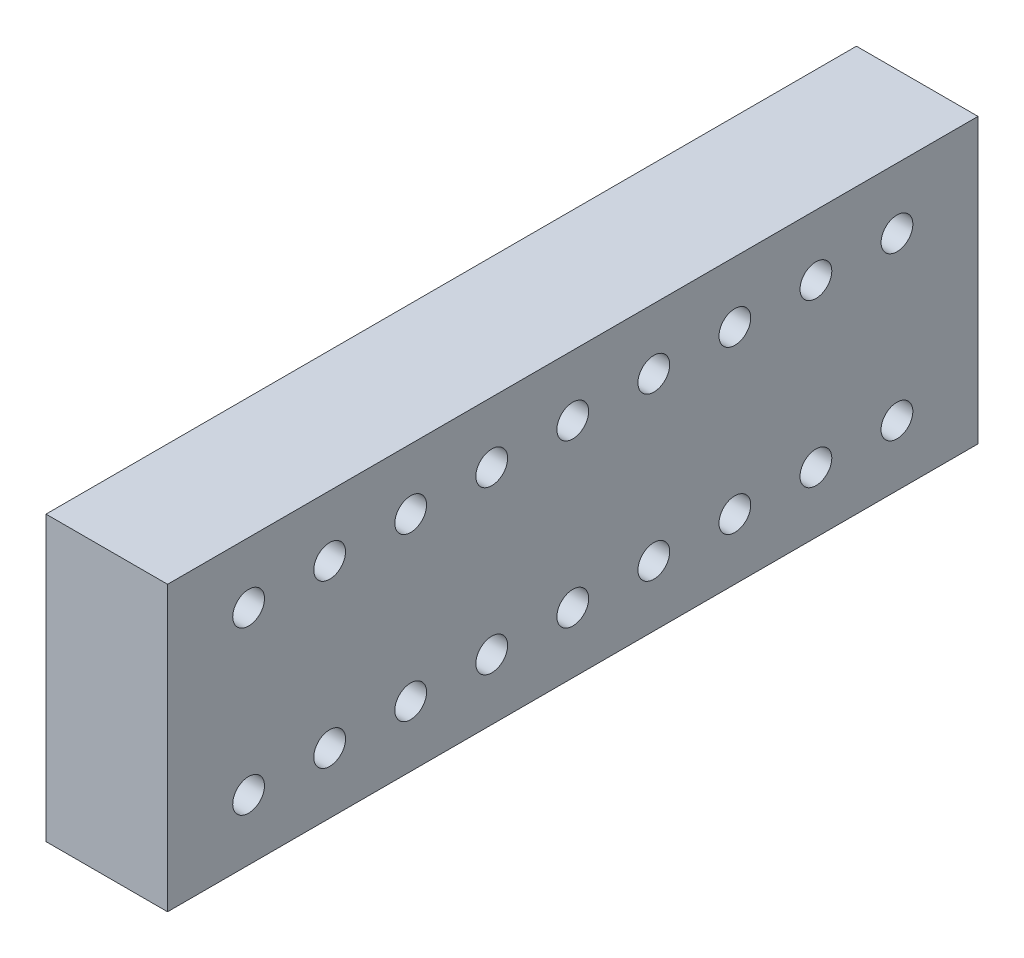
from build123d import *

# Parameters (mm, degrees)
SKETCH1_W           = 19.05
SKETCH1_H           = 44.45
BOSS_EXTRUDE1_DEPTH = 127
SKETCH2_R           = 2.4892
CUT_EXTRUDE1_DEPTH  = 136.89593445


with BuildPart() as part:
    # Sketch1 → Boss-Extrude1 (new body)
    with BuildSketch(Plane.XY):
        with Locations((9.525, 22.225)):
            Rectangle(SKETCH1_W, SKETCH1_H)
    extrude(amount=BOSS_EXTRUDE1_DEPTH)

    # Sketch2 → Cut-Extrude1 (cut, through all)
    with BuildSketch(Plane(origin=(19.05, 0, 0), x_dir=(0, 0, -1), z_dir=(1, 0, 0))):
        with Locations((-114.3, 9.525)):
            Circle(SKETCH2_R)
        with Locations((-101.6, 9.525)):
            Circle(SKETCH2_R)
        with Locations((-88.9, 9.525)):
            Circle(SKETCH2_R)
        with Locations((-114.3, 34.925)):
            Circle(SKETCH2_R)
        with Locations((-101.6, 34.925)):
            Circle(SKETCH2_R)
        with Locations((-88.9, 34.925)):
            Circle(SKETCH2_R)
        with Locations((-76.2, 9.525)):
            Circle(SKETCH2_R)
        with Locations((-63.5, 9.525)):
            Circle(SKETCH2_R)
        with Locations((-50.8, 9.525)):
            Circle(SKETCH2_R)
        with Locations((-38.1, 9.525)):
            Circle(SKETCH2_R)
        with Locations((-25.4, 9.525)):
            Circle(SKETCH2_R)
        with Locations((-12.7, 9.525)):
            Circle(SKETCH2_R)
        with Locations((-76.2, 34.925)):
            Circle(SKETCH2_R)
        with Locations((-63.5, 34.925)):
            Circle(SKETCH2_R)
        with Locations((-50.8, 34.925)):
            Circle(SKETCH2_R)
        with Locations((-38.1, 34.925)):
            Circle(SKETCH2_R)
        with Locations((-25.4, 34.925)):
            Circle(SKETCH2_R)
        with Locations((-12.7, 34.925)):
            Circle(SKETCH2_R)
    extrude(amount=-CUT_EXTRUDE1_DEPTH, mode=Mode.SUBTRACT)


solid = part.part
